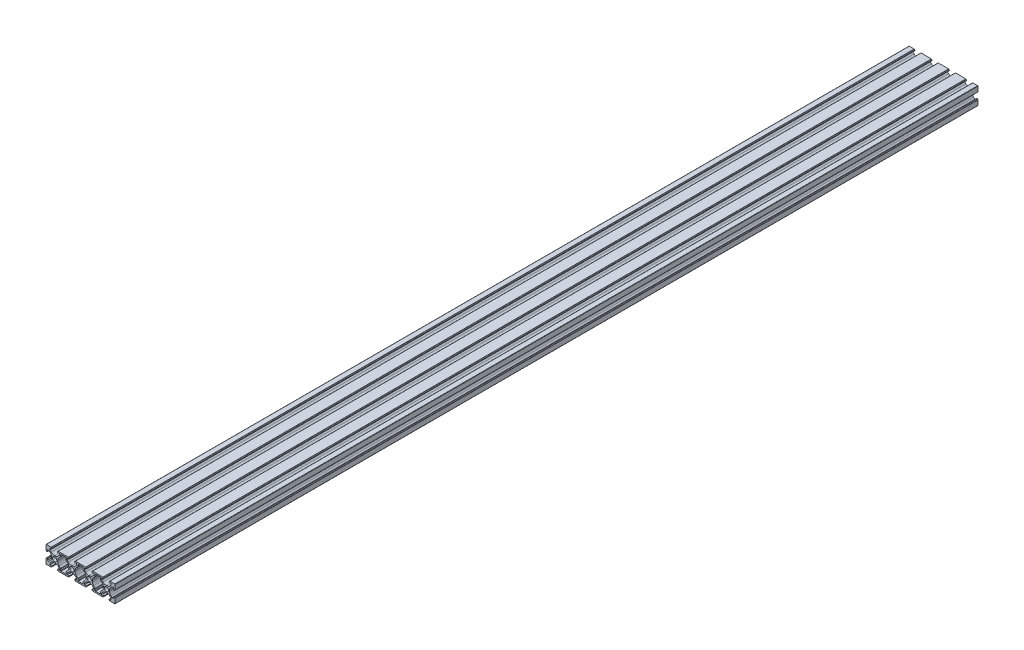
from build123d import *

# Parameters (mm, degrees)
RESSALTO_EXTRUS_O1_DEPTH    = 1000
PADR_OCIRCULAR1_COUNT       = 4
PADR_O_LINEAR1_COUNT        = 4
PADR_O_LINEAR1_PITCH        = 20
PADR_O_LINEAR1_COPY_1_DEPTH = 1000
PADR_O_LINEAR1_COPY_2_DEPTH = 1000
PADR_O_LINEAR1_COPY_3_DEPTH = 1000
PADR_O_LINEAR1_COPY_4_DEPTH = 1000
PADR_O_LINEAR1_COPY_5_DEPTH = 1000
PADR_O_LINEAR1_COPY_6_DEPTH = 1000
PADR_O_LINEAR1_COPY_7_DEPTH = 1000
PADR_O_LINEAR1_COPY_8_DEPTH = 1000
PADR_O_LINEAR1_COPY_9_DEPTH = 1000
CORTE_EXTRUS_O1_DEPTH       = 1003.496882788
PADR_O_LINEAR2_COUNT        = 3
PADR_O_LINEAR2_PITCH        = 20
FILETE1_R                   = 0.4
FILETE2_R                   = 0.4


with BuildPart() as part:
    # Esboço1 → Ressalto-extrusão1 (new body)
    with BuildSketch(Plane.XY):
        with BuildLine():
            ThreePointArc((-9.317157288, 3.217157288), (-9.187387948, 3.130448187), (-9.034314575, 3.1))
            Line((-9.034314575, 3.1), (-8.9, 3.1))
            ThreePointArc((-8.9, 3.1), (-8.617157288, 3.217157288), (-8.5, 3.5))
            Line((-8.5, 3.5), (-8.5, 5.5))
            Line((-8.5, 5.5), (-6.560660172, 5.5))
            Line((-6.560660172, 5.5), (-5.064466094, 4.003805922))
            ThreePointArc((-5.064466094, 4.003805922), (-3.980602337, 2.381689178), (-3.6, 0.468272016))
            Line((-3.6, 0.468272016), (-3.6, 0))
            Line((-3.6, 0), (-2.5, 0))
            ThreePointArc((-2.5, 0), (-1.767766953, 1.767766953), (0, 2.5))
            Line((0, 2.5), (0, 3.6))
            Line((0, 3.6), (-0.468272016, 3.6))
            ThreePointArc((-0.468272016, 3.6), (-2.381689178, 3.980602337), (-4.003805922, 5.064466094))
            Line((-4.003805922, 5.064466094), (-5.5, 6.560660172))
            Line((-5.5, 6.560660172), (-5.5, 8.5))
            Line((-5.5, 8.5), (-3.5, 8.5))
            ThreePointArc((-3.5, 8.5), (-3.217157288, 8.617157288), (-3.1, 8.9))
            Line((-3.1, 8.9), (-3.1, 9.034314575))
            ThreePointArc((-3.1, 9.034314575), (-3.130448187, 9.187387948), (-3.217157288, 9.317157288))
            Line((-3.217157288, 9.317157288), (-3.782842712, 9.882842712))
            ThreePointArc((-3.782842712, 9.882842712), (-3.912612052, 9.969551813), (-4.065685425, 10))
            Line((-4.065685425, 10), (-10, 10))
            Line((-10, 10), (-10, 4.065685425))
            ThreePointArc((-10, 4.065685425), (-9.969551813, 3.912612052), (-9.882842712, 3.782842712))
            Line((-9.882842712, 3.782842712), (-9.317157288, 3.217157288))
        make_face()
    ressalto_extrus_o1 = extrude(amount=RESSALTO_EXTRUS_O1_DEPTH)

    # PadrãoCircular1: Ressalto-extrusão1 ×4 about axis
    padr_ocircular1_axis = Axis((0, 0, 0), (0, 0, 1))
    for i in range(1, PADR_OCIRCULAR1_COUNT):
        add(ressalto_extrus_o1.rotate(padr_ocircular1_axis, i * 360 / PADR_OCIRCULAR1_COUNT))

    # Padrão linear1: Ressalto-extrusão1 ×4
    with Locations(*[(i * PADR_O_LINEAR1_PITCH, 0, 0) for i in range(1, PADR_O_LINEAR1_COUNT)]):
        add(ressalto_extrus_o1)

    # Padrão linear1 copy 1 sketch → Padrão linear1 copy 1 (add)
    with BuildSketch(Plane(origin=(20, 0, 0), x_dir=(0, 1, 0), z_dir=(0, 0, 1))):
        with BuildLine():
            ThreePointArc((-9.317157288, 3.217157288), (-9.187387948, 3.130448187), (-9.034314575, 3.1))
            Line((-9.034314575, 3.1), (-8.9, 3.1))
            ThreePointArc((-8.9, 3.1), (-8.617157288, 3.217157288), (-8.5, 3.5))
            Line((-8.5, 3.5), (-8.5, 5.5))
            Line((-8.5, 5.5), (-6.560660172, 5.5))
            Line((-6.560660172, 5.5), (-5.064466094, 4.003805922))
            ThreePointArc((-5.064466094, 4.003805922), (-3.980602337, 2.381689178), (-3.6, 0.468272016))
            Line((-3.6, 0.468272016), (-3.6, 0))
            Line((-3.6, 0), (-2.5, 0))
            ThreePointArc((-2.5, 0), (-1.767766953, 1.767766953), (0, 2.5))
            Line((0, 2.5), (0, 3.6))
            Line((0, 3.6), (-0.468272016, 3.6))
            ThreePointArc((-0.468272016, 3.6), (-2.381689178, 3.980602337), (-4.003805922, 5.064466094))
            Line((-4.003805922, 5.064466094), (-5.5, 6.560660172))
            Line((-5.5, 6.560660172), (-5.5, 8.5))
            Line((-5.5, 8.5), (-3.5, 8.5))
            ThreePointArc((-3.5, 8.5), (-3.217157288, 8.617157288), (-3.1, 8.9))
            Line((-3.1, 8.9), (-3.1, 9.034314575))
            ThreePointArc((-3.1, 9.034314575), (-3.130448187, 9.187387948), (-3.217157288, 9.317157288))
            Line((-3.217157288, 9.317157288), (-3.782842712, 9.882842712))
            ThreePointArc((-3.782842712, 9.882842712), (-3.912612052, 9.969551813), (-4.065685425, 10))
            Line((-4.065685425, 10), (-10, 10))
            Line((-10, 10), (-10, 4.065685425))
            ThreePointArc((-10, 4.065685425), (-9.969551813, 3.912612052), (-9.882842712, 3.782842712))
            Line((-9.882842712, 3.782842712), (-9.317157288, 3.217157288))
        make_face()
    extrude(amount=PADR_O_LINEAR1_COPY_1_DEPTH)

    # Padrão linear1 copy 2 sketch → Padrão linear1 copy 2 (add)
    with BuildSketch(Plane(origin=(40, 0, 0), x_dir=(0, 1, 0), z_dir=(0, 0, 1))):
        with BuildLine():
            ThreePointArc((-9.317157288, 3.217157288), (-9.187387948, 3.130448187), (-9.034314575, 3.1))
            Line((-9.034314575, 3.1), (-8.9, 3.1))
            ThreePointArc((-8.9, 3.1), (-8.617157288, 3.217157288), (-8.5, 3.5))
            Line((-8.5, 3.5), (-8.5, 5.5))
            Line((-8.5, 5.5), (-6.560660172, 5.5))
            Line((-6.560660172, 5.5), (-5.064466094, 4.003805922))
            ThreePointArc((-5.064466094, 4.003805922), (-3.980602337, 2.381689178), (-3.6, 0.468272016))
            Line((-3.6, 0.468272016), (-3.6, 0))
            Line((-3.6, 0), (-2.5, 0))
            ThreePointArc((-2.5, 0), (-1.767766953, 1.767766953), (0, 2.5))
            Line((0, 2.5), (0, 3.6))
            Line((0, 3.6), (-0.468272016, 3.6))
            ThreePointArc((-0.468272016, 3.6), (-2.381689178, 3.980602337), (-4.003805922, 5.064466094))
            Line((-4.003805922, 5.064466094), (-5.5, 6.560660172))
            Line((-5.5, 6.560660172), (-5.5, 8.5))
            Line((-5.5, 8.5), (-3.5, 8.5))
            ThreePointArc((-3.5, 8.5), (-3.217157288, 8.617157288), (-3.1, 8.9))
            Line((-3.1, 8.9), (-3.1, 9.034314575))
            ThreePointArc((-3.1, 9.034314575), (-3.130448187, 9.187387948), (-3.217157288, 9.317157288))
            Line((-3.217157288, 9.317157288), (-3.782842712, 9.882842712))
            ThreePointArc((-3.782842712, 9.882842712), (-3.912612052, 9.969551813), (-4.065685425, 10))
            Line((-4.065685425, 10), (-10, 10))
            Line((-10, 10), (-10, 4.065685425))
            ThreePointArc((-10, 4.065685425), (-9.969551813, 3.912612052), (-9.882842712, 3.782842712))
            Line((-9.882842712, 3.782842712), (-9.317157288, 3.217157288))
        make_face()
    extrude(amount=PADR_O_LINEAR1_COPY_2_DEPTH)

    # Padrão linear1 copy 3 sketch → Padrão linear1 copy 3 (add)
    with BuildSketch(Plane(origin=(60, 0, 0), x_dir=(0, 1, 0), z_dir=(0, 0, 1))):
        with BuildLine():
            ThreePointArc((-9.317157288, 3.217157288), (-9.187387948, 3.130448187), (-9.034314575, 3.1))
            Line((-9.034314575, 3.1), (-8.9, 3.1))
            ThreePointArc((-8.9, 3.1), (-8.617157288, 3.217157288), (-8.5, 3.5))
            Line((-8.5, 3.5), (-8.5, 5.5))
            Line((-8.5, 5.5), (-6.560660172, 5.5))
            Line((-6.560660172, 5.5), (-5.064466094, 4.003805922))
            ThreePointArc((-5.064466094, 4.003805922), (-3.980602337, 2.381689178), (-3.6, 0.468272016))
            Line((-3.6, 0.468272016), (-3.6, 0))
            Line((-3.6, 0), (-2.5, 0))
            ThreePointArc((-2.5, 0), (-1.767766953, 1.767766953), (0, 2.5))
            Line((0, 2.5), (0, 3.6))
            Line((0, 3.6), (-0.468272016, 3.6))
            ThreePointArc((-0.468272016, 3.6), (-2.381689178, 3.980602337), (-4.003805922, 5.064466094))
            Line((-4.003805922, 5.064466094), (-5.5, 6.560660172))
            Line((-5.5, 6.560660172), (-5.5, 8.5))
            Line((-5.5, 8.5), (-3.5, 8.5))
            ThreePointArc((-3.5, 8.5), (-3.217157288, 8.617157288), (-3.1, 8.9))
            Line((-3.1, 8.9), (-3.1, 9.034314575))
            ThreePointArc((-3.1, 9.034314575), (-3.130448187, 9.187387948), (-3.217157288, 9.317157288))
            Line((-3.217157288, 9.317157288), (-3.782842712, 9.882842712))
            ThreePointArc((-3.782842712, 9.882842712), (-3.912612052, 9.969551813), (-4.065685425, 10))
            Line((-4.065685425, 10), (-10, 10))
            Line((-10, 10), (-10, 4.065685425))
            ThreePointArc((-10, 4.065685425), (-9.969551813, 3.912612052), (-9.882842712, 3.782842712))
            Line((-9.882842712, 3.782842712), (-9.317157288, 3.217157288))
        make_face()
    extrude(amount=PADR_O_LINEAR1_COPY_3_DEPTH)

    # Padrão linear1 copy 4 sketch → Padrão linear1 copy 4 (add)
    with BuildSketch(Plane(origin=(20, 0, 0), x_dir=(-1, 0, 0), z_dir=(0, 0, 1))):
        with BuildLine():
            ThreePointArc((-9.317157288, 3.217157288), (-9.187387948, 3.130448187), (-9.034314575, 3.1))
            Line((-9.034314575, 3.1), (-8.9, 3.1))
            ThreePointArc((-8.9, 3.1), (-8.617157288, 3.217157288), (-8.5, 3.5))
            Line((-8.5, 3.5), (-8.5, 5.5))
            Line((-8.5, 5.5), (-6.560660172, 5.5))
            Line((-6.560660172, 5.5), (-5.064466094, 4.003805922))
            ThreePointArc((-5.064466094, 4.003805922), (-3.980602337, 2.381689178), (-3.6, 0.468272016))
            Line((-3.6, 0.468272016), (-3.6, 0))
            Line((-3.6, 0), (-2.5, 0))
            ThreePointArc((-2.5, 0), (-1.767766953, 1.767766953), (0, 2.5))
            Line((0, 2.5), (0, 3.6))
            Line((0, 3.6), (-0.468272016, 3.6))
            ThreePointArc((-0.468272016, 3.6), (-2.381689178, 3.980602337), (-4.003805922, 5.064466094))
            Line((-4.003805922, 5.064466094), (-5.5, 6.560660172))
            Line((-5.5, 6.560660172), (-5.5, 8.5))
            Line((-5.5, 8.5), (-3.5, 8.5))
            ThreePointArc((-3.5, 8.5), (-3.217157288, 8.617157288), (-3.1, 8.9))
            Line((-3.1, 8.9), (-3.1, 9.034314575))
            ThreePointArc((-3.1, 9.034314575), (-3.130448187, 9.187387948), (-3.217157288, 9.317157288))
            Line((-3.217157288, 9.317157288), (-3.782842712, 9.882842712))
            ThreePointArc((-3.782842712, 9.882842712), (-3.912612052, 9.969551813), (-4.065685425, 10))
            Line((-4.065685425, 10), (-10, 10))
            Line((-10, 10), (-10, 4.065685425))
            ThreePointArc((-10, 4.065685425), (-9.969551813, 3.912612052), (-9.882842712, 3.782842712))
            Line((-9.882842712, 3.782842712), (-9.317157288, 3.217157288))
        make_face()
    extrude(amount=PADR_O_LINEAR1_COPY_4_DEPTH)

    # Padrão linear1 copy 5 sketch → Padrão linear1 copy 5 (add)
    with BuildSketch(Plane(origin=(40, 0, 0), x_dir=(-1, 0, 0), z_dir=(0, 0, 1))):
        with BuildLine():
            ThreePointArc((-9.317157288, 3.217157288), (-9.187387948, 3.130448187), (-9.034314575, 3.1))
            Line((-9.034314575, 3.1), (-8.9, 3.1))
            ThreePointArc((-8.9, 3.1), (-8.617157288, 3.217157288), (-8.5, 3.5))
            Line((-8.5, 3.5), (-8.5, 5.5))
            Line((-8.5, 5.5), (-6.560660172, 5.5))
            Line((-6.560660172, 5.5), (-5.064466094, 4.003805922))
            ThreePointArc((-5.064466094, 4.003805922), (-3.980602337, 2.381689178), (-3.6, 0.468272016))
            Line((-3.6, 0.468272016), (-3.6, 0))
            Line((-3.6, 0), (-2.5, 0))
            ThreePointArc((-2.5, 0), (-1.767766953, 1.767766953), (0, 2.5))
            Line((0, 2.5), (0, 3.6))
            Line((0, 3.6), (-0.468272016, 3.6))
            ThreePointArc((-0.468272016, 3.6), (-2.381689178, 3.980602337), (-4.003805922, 5.064466094))
            Line((-4.003805922, 5.064466094), (-5.5, 6.560660172))
            Line((-5.5, 6.560660172), (-5.5, 8.5))
            Line((-5.5, 8.5), (-3.5, 8.5))
            ThreePointArc((-3.5, 8.5), (-3.217157288, 8.617157288), (-3.1, 8.9))
            Line((-3.1, 8.9), (-3.1, 9.034314575))
            ThreePointArc((-3.1, 9.034314575), (-3.130448187, 9.187387948), (-3.217157288, 9.317157288))
            Line((-3.217157288, 9.317157288), (-3.782842712, 9.882842712))
            ThreePointArc((-3.782842712, 9.882842712), (-3.912612052, 9.969551813), (-4.065685425, 10))
            Line((-4.065685425, 10), (-10, 10))
            Line((-10, 10), (-10, 4.065685425))
            ThreePointArc((-10, 4.065685425), (-9.969551813, 3.912612052), (-9.882842712, 3.782842712))
            Line((-9.882842712, 3.782842712), (-9.317157288, 3.217157288))
        make_face()
    extrude(amount=PADR_O_LINEAR1_COPY_5_DEPTH)

    # Padrão linear1 copy 6 sketch → Padrão linear1 copy 6 (add)
    with BuildSketch(Plane(origin=(60, 0, 0), x_dir=(-1, 0, 0), z_dir=(0, 0, 1))):
        with BuildLine():
            ThreePointArc((-9.317157288, 3.217157288), (-9.187387948, 3.130448187), (-9.034314575, 3.1))
            Line((-9.034314575, 3.1), (-8.9, 3.1))
            ThreePointArc((-8.9, 3.1), (-8.617157288, 3.217157288), (-8.5, 3.5))
            Line((-8.5, 3.5), (-8.5, 5.5))
            Line((-8.5, 5.5), (-6.560660172, 5.5))
            Line((-6.560660172, 5.5), (-5.064466094, 4.003805922))
            ThreePointArc((-5.064466094, 4.003805922), (-3.980602337, 2.381689178), (-3.6, 0.468272016))
            Line((-3.6, 0.468272016), (-3.6, 0))
            Line((-3.6, 0), (-2.5, 0))
            ThreePointArc((-2.5, 0), (-1.767766953, 1.767766953), (0, 2.5))
            Line((0, 2.5), (0, 3.6))
            Line((0, 3.6), (-0.468272016, 3.6))
            ThreePointArc((-0.468272016, 3.6), (-2.381689178, 3.980602337), (-4.003805922, 5.064466094))
            Line((-4.003805922, 5.064466094), (-5.5, 6.560660172))
            Line((-5.5, 6.560660172), (-5.5, 8.5))
            Line((-5.5, 8.5), (-3.5, 8.5))
            ThreePointArc((-3.5, 8.5), (-3.217157288, 8.617157288), (-3.1, 8.9))
            Line((-3.1, 8.9), (-3.1, 9.034314575))
            ThreePointArc((-3.1, 9.034314575), (-3.130448187, 9.187387948), (-3.217157288, 9.317157288))
            Line((-3.217157288, 9.317157288), (-3.782842712, 9.882842712))
            ThreePointArc((-3.782842712, 9.882842712), (-3.912612052, 9.969551813), (-4.065685425, 10))
            Line((-4.065685425, 10), (-10, 10))
            Line((-10, 10), (-10, 4.065685425))
            ThreePointArc((-10, 4.065685425), (-9.969551813, 3.912612052), (-9.882842712, 3.782842712))
            Line((-9.882842712, 3.782842712), (-9.317157288, 3.217157288))
        make_face()
    extrude(amount=PADR_O_LINEAR1_COPY_6_DEPTH)

    # Padrão linear1 copy 7 sketch → Padrão linear1 copy 7 (add)
    with BuildSketch(Plane(origin=(20, 0, 0), x_dir=(0, -1, 0), z_dir=(0, 0, 1))):
        with BuildLine():
            ThreePointArc((-9.317157288, 3.217157288), (-9.187387948, 3.130448187), (-9.034314575, 3.1))
            Line((-9.034314575, 3.1), (-8.9, 3.1))
            ThreePointArc((-8.9, 3.1), (-8.617157288, 3.217157288), (-8.5, 3.5))
            Line((-8.5, 3.5), (-8.5, 5.5))
            Line((-8.5, 5.5), (-6.560660172, 5.5))
            Line((-6.560660172, 5.5), (-5.064466094, 4.003805922))
            ThreePointArc((-5.064466094, 4.003805922), (-3.980602337, 2.381689178), (-3.6, 0.468272016))
            Line((-3.6, 0.468272016), (-3.6, 0))
            Line((-3.6, 0), (-2.5, 0))
            ThreePointArc((-2.5, 0), (-1.767766953, 1.767766953), (0, 2.5))
            Line((0, 2.5), (0, 3.6))
            Line((0, 3.6), (-0.468272016, 3.6))
            ThreePointArc((-0.468272016, 3.6), (-2.381689178, 3.980602337), (-4.003805922, 5.064466094))
            Line((-4.003805922, 5.064466094), (-5.5, 6.560660172))
            Line((-5.5, 6.560660172), (-5.5, 8.5))
            Line((-5.5, 8.5), (-3.5, 8.5))
            ThreePointArc((-3.5, 8.5), (-3.217157288, 8.617157288), (-3.1, 8.9))
            Line((-3.1, 8.9), (-3.1, 9.034314575))
            ThreePointArc((-3.1, 9.034314575), (-3.130448187, 9.187387948), (-3.217157288, 9.317157288))
            Line((-3.217157288, 9.317157288), (-3.782842712, 9.882842712))
            ThreePointArc((-3.782842712, 9.882842712), (-3.912612052, 9.969551813), (-4.065685425, 10))
            Line((-4.065685425, 10), (-10, 10))
            Line((-10, 10), (-10, 4.065685425))
            ThreePointArc((-10, 4.065685425), (-9.969551813, 3.912612052), (-9.882842712, 3.782842712))
            Line((-9.882842712, 3.782842712), (-9.317157288, 3.217157288))
        make_face()
    extrude(amount=PADR_O_LINEAR1_COPY_7_DEPTH)

    # Padrão linear1 copy 8 sketch → Padrão linear1 copy 8 (add)
    with BuildSketch(Plane(origin=(40, 0, 0), x_dir=(0, -1, 0), z_dir=(0, 0, 1))):
        with BuildLine():
            ThreePointArc((-9.317157288, 3.217157288), (-9.187387948, 3.130448187), (-9.034314575, 3.1))
            Line((-9.034314575, 3.1), (-8.9, 3.1))
            ThreePointArc((-8.9, 3.1), (-8.617157288, 3.217157288), (-8.5, 3.5))
            Line((-8.5, 3.5), (-8.5, 5.5))
            Line((-8.5, 5.5), (-6.560660172, 5.5))
            Line((-6.560660172, 5.5), (-5.064466094, 4.003805922))
            ThreePointArc((-5.064466094, 4.003805922), (-3.980602337, 2.381689178), (-3.6, 0.468272016))
            Line((-3.6, 0.468272016), (-3.6, 0))
            Line((-3.6, 0), (-2.5, 0))
            ThreePointArc((-2.5, 0), (-1.767766953, 1.767766953), (0, 2.5))
            Line((0, 2.5), (0, 3.6))
            Line((0, 3.6), (-0.468272016, 3.6))
            ThreePointArc((-0.468272016, 3.6), (-2.381689178, 3.980602337), (-4.003805922, 5.064466094))
            Line((-4.003805922, 5.064466094), (-5.5, 6.560660172))
            Line((-5.5, 6.560660172), (-5.5, 8.5))
            Line((-5.5, 8.5), (-3.5, 8.5))
            ThreePointArc((-3.5, 8.5), (-3.217157288, 8.617157288), (-3.1, 8.9))
            Line((-3.1, 8.9), (-3.1, 9.034314575))
            ThreePointArc((-3.1, 9.034314575), (-3.130448187, 9.187387948), (-3.217157288, 9.317157288))
            Line((-3.217157288, 9.317157288), (-3.782842712, 9.882842712))
            ThreePointArc((-3.782842712, 9.882842712), (-3.912612052, 9.969551813), (-4.065685425, 10))
            Line((-4.065685425, 10), (-10, 10))
            Line((-10, 10), (-10, 4.065685425))
            ThreePointArc((-10, 4.065685425), (-9.969551813, 3.912612052), (-9.882842712, 3.782842712))
            Line((-9.882842712, 3.782842712), (-9.317157288, 3.217157288))
        make_face()
    extrude(amount=PADR_O_LINEAR1_COPY_8_DEPTH)

    # Padrão linear1 copy 9 sketch → Padrão linear1 copy 9 (add)
    with BuildSketch(Plane(origin=(60, 0, 0), x_dir=(0, -1, 0), z_dir=(0, 0, 1))):
        with BuildLine():
            ThreePointArc((-9.317157288, 3.217157288), (-9.187387948, 3.130448187), (-9.034314575, 3.1))
            Line((-9.034314575, 3.1), (-8.9, 3.1))
            ThreePointArc((-8.9, 3.1), (-8.617157288, 3.217157288), (-8.5, 3.5))
            Line((-8.5, 3.5), (-8.5, 5.5))
            Line((-8.5, 5.5), (-6.560660172, 5.5))
            Line((-6.560660172, 5.5), (-5.064466094, 4.003805922))
            ThreePointArc((-5.064466094, 4.003805922), (-3.980602337, 2.381689178), (-3.6, 0.468272016))
            Line((-3.6, 0.468272016), (-3.6, 0))
            Line((-3.6, 0), (-2.5, 0))
            ThreePointArc((-2.5, 0), (-1.767766953, 1.767766953), (0, 2.5))
            Line((0, 2.5), (0, 3.6))
            Line((0, 3.6), (-0.468272016, 3.6))
            ThreePointArc((-0.468272016, 3.6), (-2.381689178, 3.980602337), (-4.003805922, 5.064466094))
            Line((-4.003805922, 5.064466094), (-5.5, 6.560660172))
            Line((-5.5, 6.560660172), (-5.5, 8.5))
            Line((-5.5, 8.5), (-3.5, 8.5))
            ThreePointArc((-3.5, 8.5), (-3.217157288, 8.617157288), (-3.1, 8.9))
            Line((-3.1, 8.9), (-3.1, 9.034314575))
            ThreePointArc((-3.1, 9.034314575), (-3.130448187, 9.187387948), (-3.217157288, 9.317157288))
            Line((-3.217157288, 9.317157288), (-3.782842712, 9.882842712))
            ThreePointArc((-3.782842712, 9.882842712), (-3.912612052, 9.969551813), (-4.065685425, 10))
            Line((-4.065685425, 10), (-10, 10))
            Line((-10, 10), (-10, 4.065685425))
            ThreePointArc((-10, 4.065685425), (-9.969551813, 3.912612052), (-9.882842712, 3.782842712))
            Line((-9.882842712, 3.782842712), (-9.317157288, 3.217157288))
        make_face()
    extrude(amount=PADR_O_LINEAR1_COPY_9_DEPTH)

    # Esboço4 → Corte-extrusão1 (cut, through all)
    with BuildSketch(Plane(origin=(0, 0, 0), x_dir=(-1, 0, 0), z_dir=(0, 0, -1))):
        Polygon((-13.439339828, 5.5), (-13, 5.939339828), (-13, 8.5), (-7, 8.5), (-7, 5.939339828), (-6.560660172, 5.5), (-6.560660172, -5.5), (-7, -5.939339828), (-7, -8.5), (-13, -8.5), (-13, -5.939339828), (-13.439339828, -5.5), align=None)
    corte_extrus_o1 = extrude(amount=-CORTE_EXTRUS_O1_DEPTH, mode=Mode.SUBTRACT)

    # Padrão linear2: Corte-extrusão1 ×3
    with Locations(*[(i * PADR_O_LINEAR2_PITCH, 0, 0) for i in range(1, PADR_O_LINEAR2_COUNT)]):
        add(corte_extrus_o1, mode=Mode.SUBTRACT)

    # Filete1
    filete1_edges = [part.edges().sort_by_distance(p)[0] for p in [
        (13, 5.939339828, 500),
        (13, 8.5, 500),
        (7, 8.5, 500),
        (7, 5.939339828, 500),
        (7, -5.939339828, 500),
        (7, -8.5, 500),
        (13, -8.5, 500),
        (13, -5.939339828, 500),
        (33, 5.939339828, 500),
        (33, 8.5, 500),
        (27, 8.5, 500),
        (27, 5.939339828, 500),
        (27, -5.939339828, 500),
        (27, -8.5, 500),
        (33, -8.5, 500),
        (33, -5.939339828, 500),
        (53, 5.939339828, 500),
        (53, 8.5, 500),
        (47, 8.5, 500),
        (47, 5.939339828, 500),
        (47, -5.939339828, 500),
        (47, -8.5, 500),
        (53, -8.5, 500),
        (53, -5.939339828, 500),
    ]]
    fillet(filete1_edges, radius=FILETE1_R)

    # Filete2
    filete2_edges = [part.edges().sort_by_distance(p)[0] for p in [
        (-10, 10, 500),
        (70, -10, 500),
        (70, 10, 500),
        (-10, -10, 500),
    ]]
    fillet(filete2_edges, radius=FILETE2_R)


solid = part.part
